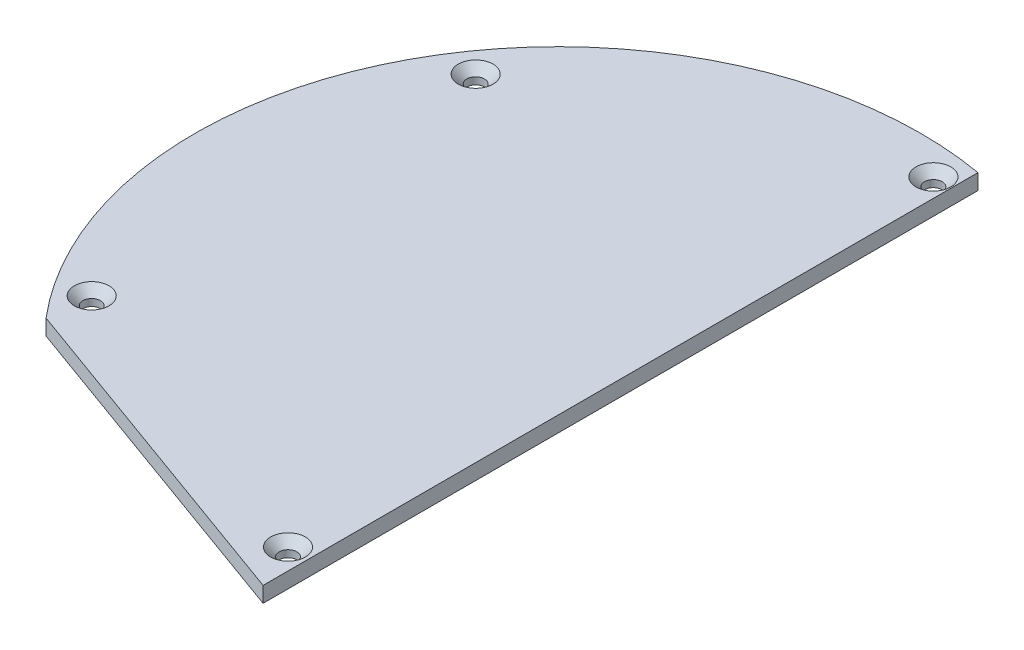
from build123d import *

# Parameters (mm, degrees)
BOSS_EXTRUDE1_DEPTH                            = 3
CSK_FOR_M3_FLAT_HEAD_MACHINE_SCREW1_AT_2_COUNT = 2
CSK_FOR_M3_FLAT_HEAD_MACHINE_SCREW1_AT_2_PITCH = 73.991360289
CSK_FOR_M3_FLAT_HEAD_MACHINE_SCREW1_AT_3_COUNT = 2
CSK_FOR_M3_FLAT_HEAD_MACHINE_SCREW1_AT_3_PITCH = 114.494962889
CSK_FOR_M3_FLAT_HEAD_MACHINE_SCREW1_AT_4_COUNT = 2
CSK_FOR_M3_FLAT_HEAD_MACHINE_SCREW1_AT_4_PITCH = 66.921750303


with BuildPart() as part:
    # Sketch1 → Boss-Extrude1 (new body)
    with BuildSketch(Plane(origin=(0, 0, 0), x_dir=(1, 0, 0), z_dir=(0, 1, 0))):
        with BuildLine():
            Line((12, 68.963758598), (12, -68.802405773))
            Line((12, -68.802405773), (-53.528576558, -45.107554707))
            ThreePointArc((-53.528576558, -45.107554707), (-60.697790714, 34.868011163), (12, 68.963758598))
        make_face()
    extrude(amount=BOSS_EXTRUDE1_DEPTH)

    # Sketch4 → CSK for M3 Flat Head Machine Screw1 (revolve, cut)
    with BuildSketch(Plane(origin=(-52.835306857, 3, -36.995680145), x_dir=(0, 0, 1), z_dir=(1, 0, 0))):
        Polygon((0, 0), (0, 3), (1.7, 3), (1.7, 1.65), (3.35, 0), align=None)
    csk_for_m3_flat_head_machine_screw1 = revolve(axis=Axis((-52.835306857, 9.35, -36.995680145), (0, -1, 0)), mode=Mode.SUBTRACT)

    # CSK for M3 Flat Head Machine Screw1 at 2: CSK for M3 Flat Head Machine Screw1 ×2
    with Locations(*[(0, 0, i * CSK_FOR_M3_FLAT_HEAD_MACHINE_SCREW1_AT_2_PITCH) for i in range(1, CSK_FOR_M3_FLAT_HEAD_MACHINE_SCREW1_AT_2_COUNT)]):
        add(csk_for_m3_flat_head_machine_screw1, mode=Mode.SUBTRACT)

    # CSK for M3 Flat Head Machine Screw1 at 3: CSK for M3 Flat Head Machine Screw1 ×2
    with Locations(*[Vector(0.5313360982994817, 0, 0.8471611125658941) * (i * CSK_FOR_M3_FLAT_HEAD_MACHINE_SCREW1_AT_3_PITCH) for i in range(1, CSK_FOR_M3_FLAT_HEAD_MACHINE_SCREW1_AT_3_COUNT)]):
        add(csk_for_m3_flat_head_machine_screw1, mode=Mode.SUBTRACT)

    # CSK for M3 Flat Head Machine Screw1 at 4: CSK for M3 Flat Head Machine Screw1 ×2
    with Locations(*[Vector(0.9153114791194467, 0, -0.40274668985873835) * (i * CSK_FOR_M3_FLAT_HEAD_MACHINE_SCREW1_AT_4_PITCH) for i in range(1, CSK_FOR_M3_FLAT_HEAD_MACHINE_SCREW1_AT_4_COUNT)]):
        add(csk_for_m3_flat_head_machine_screw1, mode=Mode.SUBTRACT)


solid = part.part
